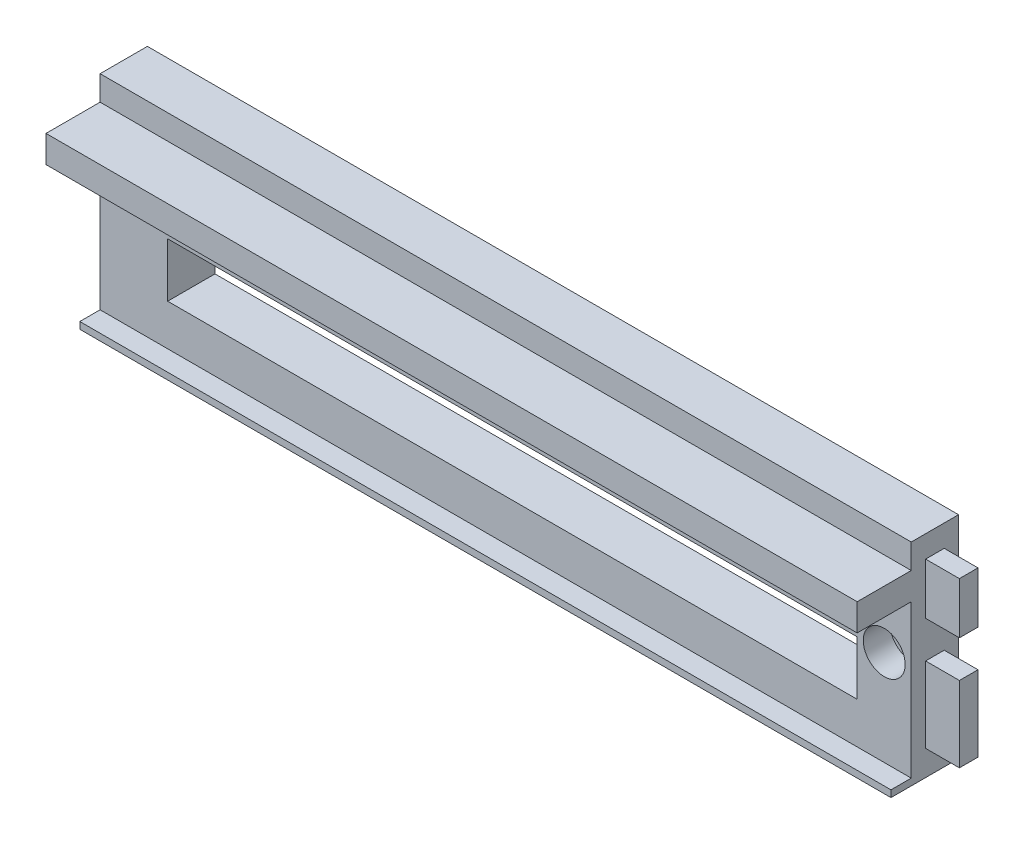
from build123d import *

# Parameters (mm, degrees)
SKETCH1_W               = 120
SKETCH1_H               = 31.25
BOSS_EXTRUDE1_DEPTH     = 7
SKETCH2_W               = 120
SKETCH2_H               = 4
SKETCH2_H_2             = 1
BOSS_EXTRUDE2_DEPTH     = 8
CUT_EXTRUDE1_DEPTH      = 125.260059955
CUT_EXTRUDE1_DEPTH_BACK = 125.260059955
SKETCH3_W               = 102
SKETCH3_H               = 8
SKETCH3_H_2             = 3.5
CUT_EXTRUDE3_REACH      = 126.906
SKETCH6_W               = 5
SKETCH6_H               = 1
SKETCH4_W               = 3
SKETCH4_H               = 8.090611825
SKETCH4_H_2             = 10.659388175
CUT_EXTRUDE4_DEPTH      = 5
SKETCH5_W               = 2.75
SKETCH5_H               = 7.59
SKETCH5_H_2             = 11.2
BOSS_EXTRUDE3_DEPTH     = 5
SKETCH7_R               = 3.1
CUT_EXTRUDE5_DEPTH      = 4
CUT_EXTRUDE6_START      = -1
SKETCH8_R               = 3.1
CUT_EXTRUDE6_DEPTH      = 1
CHAMFER1_SIZE           = 1


with BuildPart() as part:
    # Sketch1 → Boss-Extrude1 (new body)
    with BuildSketch(Plane.XY):
        with Locations((60, 15.625)):
            Rectangle(SKETCH1_W, SKETCH1_H)
    extrude(amount=BOSS_EXTRUDE1_DEPTH)

    # Sketch2 → Boss-Extrude2 (add)
    with BuildSketch(Plane.XY.offset(7)):
        with Locations((60, 25.6)):
            Rectangle(SKETCH2_W, SKETCH2_H)
        with Locations((60, 0.5)):
            Rectangle(SKETCH2_W, SKETCH2_H_2)
    extrude(amount=BOSS_EXTRUDE2_DEPTH)

    # Sketch3 → Cut-Extrude1 (cut, two sides: drawn at the far end of the back side and taken through both)
    with BuildSketch(Plane.XY.offset(7).offset(-CUT_EXTRUDE1_DEPTH_BACK)):
        with Locations((61, 11.1)):
            Rectangle(SKETCH3_W, SKETCH3_H)
        with Locations((61, 21.85)):
            Rectangle(SKETCH3_W, SKETCH3_H_2)
    extrude(amount=CUT_EXTRUDE1_DEPTH + CUT_EXTRUDE1_DEPTH_BACK, mode=Mode.SUBTRACT)

    # Sketch6 → Cut-Extrude3 (cut, up to next)
    with BuildSketch(Plane.ZY, mode=Mode.PRIVATE) as cut_extrude3_sk1:
        with Locations((12.5, 0.5)):
            Rectangle(SKETCH6_W, SKETCH6_H)
    cut_extrude3_tool1 = extrude(cut_extrude3_sk1.sketch, amount=-CUT_EXTRUDE3_REACH, mode=Mode.PRIVATE) & part.part
    add(cut_extrude3_tool1.solids().sort_by_distance((0, 0.5, 12.5))[0], mode=Mode.SUBTRACT)

    # Sketch4 → Cut-Extrude4 (cut)
    with BuildSketch(Plane.ZY):
        with Locations((3.5, 24.204694088)):
            Rectangle(SKETCH4_W, SKETCH4_H)
        with Locations((3.5, 8.829694088)):
            Rectangle(SKETCH4_W, SKETCH4_H_2)
    extrude(amount=-CUT_EXTRUDE4_DEPTH, mode=Mode.SUBTRACT)

    # Sketch5 → Boss-Extrude3 (add)
    with BuildSketch(Plane(origin=(120, 0, 0), x_dir=(0, 0, -1), z_dir=(1, 0, 0))):
        with Locations((-3.5, 24.205)):
            Rectangle(SKETCH5_W, SKETCH5_H)
        with Locations((-3.5, 9.35)):
            Rectangle(SKETCH5_W, SKETCH5_H_2)
    extrude(amount=BOSS_EXTRUDE3_DEPTH)

    # Sketch7 → Cut-Extrude5 (cut)
    with BuildSketch(Plane.XY.offset(7)):
        with Locations((116, 15.1)):
            Circle(SKETCH7_R)
    extrude(amount=-CUT_EXTRUDE5_DEPTH, mode=Mode.SUBTRACT)

    # Sketch8 → Cut-Extrude6 (cut)
    with BuildSketch(Plane(origin=(0, 0, 0), x_dir=(-1, 0, 0), z_dir=(0, 0, -1)).offset(CUT_EXTRUDE6_START)):
        with Locations(Location((-116, 15.1, 0), (0, 0, 180))):
            Circle(SKETCH8_R)
    extrude(amount=CUT_EXTRUDE6_DEPTH, mode=Mode.SUBTRACT)

    # Chamfer1
    chamfer1_edges = [part.edges().sort_by_distance(p)[0] for p in [
        (112.9, 15.1, 1),
    ]]
    chamfer(chamfer1_edges, length=CHAMFER1_SIZE - 0.0001)  # a hair under: the kernel refuses the full size


solid = part.part
